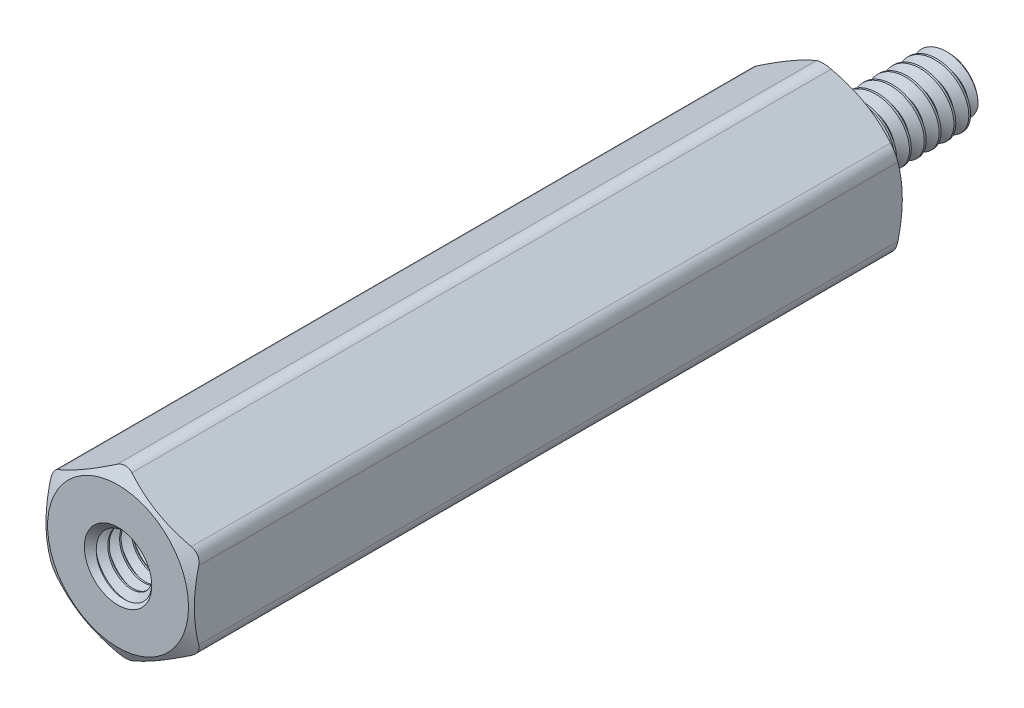
from build123d import *

# Parameters (mm, degrees)
SKETCH4_R              = 2.860675
BOSS_EXTRUDE1_DEPTH    = 38.1
SKETCH5_OUTSIDE_W      = 178.022
SKETCH5_OUTSIDE_H      = 179.25
SKETCH5_OUTSIDE_R      = 3.7703125
CUT_EXTRUDE1_DEPTH     = 45.861506647
CUT_EXTRUDE1_DRAFT     = -60
SKETCH6_OUTSIDE_W      = 156.26
SKETCH6_OUTSIDE_H      = 157.488
SKETCH6_OUTSIDE_R      = 3.7703125
CUT_EXTRUDE2_DEPTH     = 39.579298576
CUT_EXTRUDE2_DRAFT     = -60
FILLET1_R              = 0.79375
CUT_SWEEP1_PITCH       = 0.79375
CUT_SWEEP1_HEIGHT      = 6.1595
CUT_SWEEP1_RADIUS      = 1.7526
CUT_SWEEP1_START_ANGLE = 90
SKETCH9_R              = 1.9510375
BOSS_EXTRUDE2_DEPTH    = 9.525
SKETCH10_W             = 9.525
SKETCH10_H             = 1.7526
CUT_SWEEP2_PITCH       = 0.635
SKETCH13_R             = 1.8034
CUT_EXTRUDE3_DEPTH     = 0.9525
CUT_EXTRUDE3_DRAFT     = -45.118076565


with BuildPart() as part:
    # Sketch3 → Revolve1 (revolve)
    with BuildSketch(Plane(origin=(0, 0, 0), x_dir=(0, 0, -1), z_dir=(1, 0, 0))):
        with BuildLine():
            Line((-28.575, 1.5541625), (-28.575, 0))
            Line((-28.575, 0), (6.35, 0))
            Line((6.35, 0), (6.35, 1.5541625))
            Line((6.35, 1.5541625), (6.1515625, 1.7526))
            Line((6.1515625, 1.7526), (1.05965625, 1.7526))
            Line((1.05965625, 1.7526), (0.762, 1.237044252))
            Line((0.762, 1.237044252), (0.1984375, 1.237044252))
            ThreePointArc((0.1984375, 1.237044252), (0.058120998, 1.29516525), (0, 1.435481752))
            Line((0, 1.435481752), (0, 3.96875))
            Line((0, 3.96875), (-38.1, 3.96875))
            Line((-38.1, 3.96875), (-38.1, 1.9510375))
            Line((-38.1, 1.9510375), (-37.9015625, 1.7526))
            Line((-37.9015625, 1.7526), (-28.7734375, 1.7526))
            Line((-28.7734375, 1.7526), (-28.575, 1.5541625))
        make_face()
    revolve(axis=Axis((0, 0, -6.35), (0, 0, 1)))

    # Sketch4 → Boss-Extrude1 (add)
    with BuildSketch(Plane.XY.offset(38.1)):
        Polygon((-3.96875, 2.291358881), (-3.96875, -2.291358881), (0, -4.582717762), (3.96875, -2.291358881), (3.96875, 2.291358881), (0, 4.582717762), align=None)
        Circle(SKETCH4_R, mode=Mode.SUBTRACT)
    extrude(amount=-BOSS_EXTRUDE1_DEPTH)


with BuildPart() as cut_extrude1_tool:
    # Sketch5 outside → Cut-Extrude1 (with draft: the straight prism first)
    with BuildSketch(Plane.XY.offset(38.1)):
        Rectangle(SKETCH5_OUTSIDE_W, SKETCH5_OUTSIDE_H)
        Circle(SKETCH5_OUTSIDE_R, mode=Mode.SUBTRACT)
    extrude(amount=-CUT_EXTRUDE1_DEPTH)
    # Cut-Extrude1: the draft: its side faces are tilted about the plane it starts from
    cut_extrude1_sides = [cut_extrude1_tool.faces().sort_by_distance(p)[0] for p in [
        (0, -89.625, 15.169246676),
        (89.011, 0, 15.169246676),
        (0, 89.625, 15.169246676),
        (-89.011, 0, 15.169246676),
        (-3.7703125, 0, 15.169246676),
    ]]
    draft(cut_extrude1_sides, Plane.XY.offset(38.1), CUT_EXTRUDE1_DRAFT)


with BuildPart() as part_1:
    add(part.part)

    # Cut-Extrude1: cut by cut_extrude1_tool
    add(cut_extrude1_tool.part, mode=Mode.SUBTRACT)


with BuildPart() as cut_extrude2_tool:
    # Sketch6 outside → Cut-Extrude2 (with draft: the straight prism first)
    with BuildSketch(Plane(origin=(0, 0, 0), x_dir=(-1, 0, 0), z_dir=(0, 0, -1))):
        Rectangle(SKETCH6_OUTSIDE_W, SKETCH6_OUTSIDE_H)
        Circle(SKETCH6_OUTSIDE_R, mode=Mode.SUBTRACT)
    extrude(amount=-CUT_EXTRUDE2_DEPTH)
    # Cut-Extrude2: the draft: its side faces are tilted about the plane it starts from
    cut_extrude2_sides = [cut_extrude2_tool.faces().sort_by_distance(p)[0] for p in [
        (0, -78.744, 19.789649288),
        (-78.13, 0, 19.789649288),
        (0, 78.744, 19.789649288),
        (78.13, 0, 19.789649288),
        (3.7703125, 0, 19.789649288),
    ]]
    draft(cut_extrude2_sides, Plane(origin=(0, 0, 0), x_dir=(-1, 0, 0), z_dir=(0, 0, -1)), CUT_EXTRUDE2_DRAFT)


with BuildPart() as part_2:
    add(part_1.part)

    # Cut-Extrude2: cut by cut_extrude2_tool
    add(cut_extrude2_tool.part, mode=Mode.SUBTRACT)

    # Fillet1
    fillet1_edges = [part_2.edges().sort_by_distance(p)[0] for p in [
        (0, 4.582717762, 19.05),
        (-3.96875, -2.291358881, 19.05),
        (0, -4.582717762, 19.05),
        (3.96875, -2.291358881, 19.05),
        (3.96875, 2.291358881, 19.05),
        (-3.96875, 2.291358881, 19.05),
    ]]
    fillet(fillet1_edges, radius=FILLET1_R)

    # Cut-Sweep1: sweep along a helix
    with BuildLine() as cut_sweep1_path:
        add(Helix(CUT_SWEEP1_PITCH, CUT_SWEEP1_HEIGHT, CUT_SWEEP1_RADIUS, center=(0, 0, -6.35), direction=(0, 0, 1), mode=Mode.PRIVATE).rotate(Axis((0, 0, -6.35), (0, 0, 1)), CUT_SWEEP1_START_ANGLE))
    # Sketch7 → Cut-Sweep1 (sweep, cut)
    with BuildSketch(Plane.ZY):
        Polygon((-6.64765625, 1.237044252), (-6.746875, 1.237044252), (-7.069335938, 1.795562979), (-6.325195313, 1.795562979), align=None)
    sweep(path=cut_sweep1_path.line, is_frenet=True, mode=Mode.SUBTRACT)

    # Sketch9 → Boss-Extrude2 (add)
    with BuildSketch(Plane.XY.offset(28.575)):
        Circle(SKETCH9_R)
    extrude(amount=BOSS_EXTRUDE2_DEPTH)


with BuildPart() as body_2:
    # Sketch10 → Revolve2 (revolve)
    with BuildSketch(Plane(origin=(0, 0, 0), x_dir=(0, 0, -1), z_dir=(1, 0, 0))):
        with Locations((-33.3375, 0.8763)):
            Rectangle(SKETCH10_W, SKETCH10_H)
    revolve(axis=Axis((0, 0, -6.35), (0, 0, 1)))

    # Cut-Sweep2: the profile of Sketch12 screwed along a right-hand helix of 16 turns, 6 arcs to a turn; built about Z, then put on its axis
    cut_sweep2_z = Axis((0, 0, 0), (0, 0, 1))
    cut_sweep2_corners = [(1.340155401, 0, -0.3175), (1.340155401, 0, -0.238125), (1.786970383, 0, 0.01984375), (1.786970383, 0, -0.57546875)]
    with BuildLine(mode=Mode.PRIVATE) as cut_sweep2_profile:
        Line(cut_sweep2_corners[0], cut_sweep2_corners[1])
        Line(cut_sweep2_corners[1], cut_sweep2_corners[2])
        Line(cut_sweep2_corners[2], cut_sweep2_corners[3])
        Line(cut_sweep2_corners[3], cut_sweep2_corners[0])
    cut_sweep2_cap = Face(cut_sweep2_profile.wire())
    cut_sweep2_turn_angles = [0, 30, 60, 90, 120, 150, 180, 210, 240, 270, 300, 330, 360]
    cut_sweep2_turn_weights = [1, 0.8660254037844387, 1, 0.8660254037844387, 1, 0.8660254037844387, 1, 0.8660254037844387, 1, 0.8660254037844387, 1, 0.8660254037844387, 1]
    cut_sweep2_turn_rails = [Edge.make_bspline([Vector(p[0], p[1], 0).rotate(cut_sweep2_z, cut_sweep2_turn_angles[k]) / cut_sweep2_turn_weights[k] + Vector(0, 0, p[2] + CUT_SWEEP2_PITCH * cut_sweep2_turn_angles[k] / 360) for k in range(13)], [0, 0, 0, 1, 1, 2, 2, 3, 3, 4, 4, 5, 5, 6, 6, 6], 2, cut_sweep2_turn_weights) for p in cut_sweep2_corners]
    cut_sweep2_turn_sides = [Face.make_surface_from_curves(cut_sweep2_turn_rails[p[0]], cut_sweep2_turn_rails[p[1]]) for p in [(0, 1), (1, 2), (2, 3), (3, 0)]]
    cut_sweep2 = Plane(origin=(0, 0, 38.1), x_dir=(0, 1, 0), z_dir=(0, 0, -1)) * Solid(Shell([*[p.moved(Location((0, 0, CUT_SWEEP2_PITCH * i))) for i in range(16) for p in cut_sweep2_turn_sides], cut_sweep2_cap, cut_sweep2_cap.rotate(cut_sweep2_z, 5760).moved(Location((0, 0, CUT_SWEEP2_PITCH * 5760 / 360)))]))
    add(cut_sweep2, mode=Mode.SUBTRACT)


with BuildPart() as part_3:
    add(part_2.part)

    # Combine1: cut body 2
    add(body_2.part, mode=Mode.SUBTRACT)


with BuildPart() as cut_extrude3_tool:
    # Sketch13 → Cut-Extrude3 (with draft: the straight prism first)
    with BuildSketch(Plane.XY.offset(38.1)):
        Circle(SKETCH13_R)
    extrude(amount=-CUT_EXTRUDE3_DEPTH)
    # Cut-Extrude3: the draft: its side faces are tilted about the plane it starts from
    cut_extrude3_sides = [cut_extrude3_tool.faces().sort_by_distance(p)[0] for p in [
        (-1.8034, 0, 37.62375),
    ]]
    draft(cut_extrude3_sides, Plane.XY.offset(38.1), CUT_EXTRUDE3_DRAFT)


with BuildPart() as part_4:
    add(part_3.part)

    # Cut-Extrude3: cut by cut_extrude3_tool
    add(cut_extrude3_tool.part, mode=Mode.SUBTRACT)


solid = part_4.part
